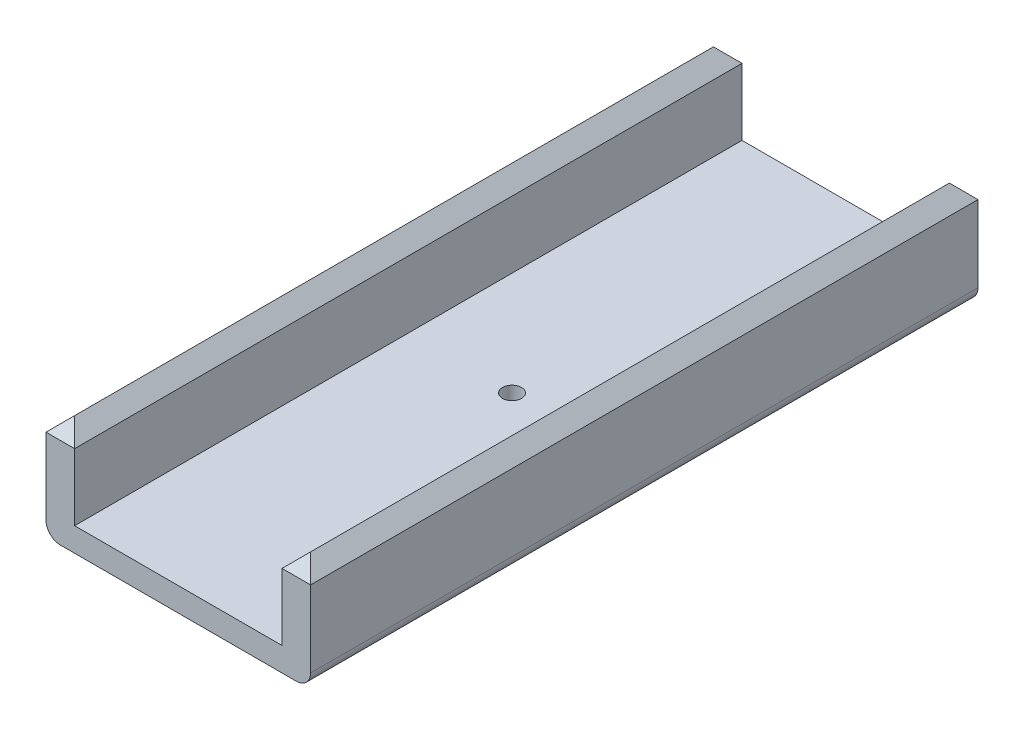
from build123d import *

# Parameters (mm, degrees)
SKETCH1_W           = 55.5
SKETCH1_H           = 25
BOSS_EXTRUDE1_DEPTH = 70
SKETCH2_W           = 43.5
SKETCH2_H           = 150
CUT_EXTRUDE1_DEPTH  = 20
SKETCH3_R           = 2
CUT_EXTRUDE2_DEPTH  = 78.910605825
FILLET1_R           = 3
CHAMFER1_SIZE       = 6


with BuildPart() as part:
    # Sketch1 → Boss-Extrude1 (new, symmetric)
    with BuildSketch(Plane.XY):
        Rectangle(SKETCH1_W, SKETCH1_H)
    extrude(amount=BOSS_EXTRUDE1_DEPTH, both=True)

    # Sketch2 → Cut-Extrude1 (cut)
    with BuildSketch(Plane(origin=(0, 12.5, 0), x_dir=(1, 0, 0), z_dir=(0, 1, 0))):
        Rectangle(SKETCH2_W, SKETCH2_H)
    extrude(amount=-CUT_EXTRUDE1_DEPTH, mode=Mode.SUBTRACT)

    # Sketch3 → Cut-Extrude2 (cut, through all)
    with BuildSketch(Plane(origin=(0, -7.5, 0), x_dir=(1, 0, 0), z_dir=(0, 1, 0))):
        with Locations(Location((0, 0, 0), (0, 0, 270))):
            Circle(SKETCH3_R)
    extrude(amount=-CUT_EXTRUDE2_DEPTH, mode=Mode.SUBTRACT)

    # Fillet1
    fillet1_edges = [part.edges().sort_by_distance(p)[0] for p in [
        (27.75, -12.5, 0),
        (-27.75, -12.5, 0),
    ]]
    fillet(fillet1_edges, radius=FILLET1_R)

    # Chamfer1
    # the kernel refuses this chamfer: 6 mm, written as the material it takes off along each edge
    with BuildSketch(Plane(origin=(-6.319902072, 12.5, -70), x_dir=(0, -0.9996219169112968, -0.027495876610586778), z_dir=(-1, 0, 0)), Plane(origin=(43.180097928, 12.5, -70), x_dir=(0, -0.9996219169112968, -0.027495876610586778), z_dir=(-1, 0, 0))) as chamfer1_piece_1:
        Polygon((CHAMFER1_SIZE * 0.999621916911, CHAMFER1_SIZE * 0.0274958766106), (-CHAMFER1_SIZE * 0.0274958766106, CHAMFER1_SIZE * 0.999621916911), (0, 0), align=None)
    extrude(amount=36.860195856, mode=Mode.SUBTRACT)
    with BuildSketch(Plane(origin=(-6.319902072, 12.5, 70), x_dir=(0, -0.9996219169112968, 0.027495876610586778), z_dir=(-1, 0, 0)), Plane(origin=(43.180097928, 12.5, 70), x_dir=(0, -0.9996219169112968, 0.027495876610586778), z_dir=(-1, 0, 0))) as chamfer1_piece_2:
        Polygon((CHAMFER1_SIZE * 0.999621916911, -CHAMFER1_SIZE * 0.0274958766106), (-CHAMFER1_SIZE * 0.0274958766106, -CHAMFER1_SIZE * 0.999621916911), (0, 0), align=None)
    extrude(amount=36.860195856, mode=Mode.SUBTRACT)
    with BuildSketch(Plane(origin=(21.75, 12.5, 85.430097928), x_dir=(-0.027495876610586202, -0.9996219169112968, 0), z_dir=(0, 0, -1)), Plane(origin=(-27.75, 12.5, 85.430097928), x_dir=(-0.027495876610586202, -0.9996219169112968, 0), z_dir=(0, 0, -1)), Plane(origin=(27.75, 12.5, -85.430097928), x_dir=(0.027495876610586202, -0.9996219169112968, 0), z_dir=(0, 0, 1))) as chamfer1_piece_3:
        Polygon((CHAMFER1_SIZE * 0.999621916911, -CHAMFER1_SIZE * 0.0274958766106), (-CHAMFER1_SIZE * 0.0274958766106, -CHAMFER1_SIZE * 0.999621916911), (0, 0), align=None)
    extrude(amount=170.860195856, mode=Mode.SUBTRACT)
    with BuildSketch(Plane(origin=(-21.75, 12.5, -85.430097928), x_dir=(-0.9996219169112969, 0.027495876610586497, 0), z_dir=(0, 0, 1))) as chamfer1_piece_4:
        Polygon((CHAMFER1_SIZE * 0.999621916911, CHAMFER1_SIZE * 0.0274958766106), (-CHAMFER1_SIZE * 0.0274958766106, CHAMFER1_SIZE * 0.999621916911), (0, 0), align=None)
    extrude(amount=170.860195856, mode=Mode.SUBTRACT)


solid = part.part
